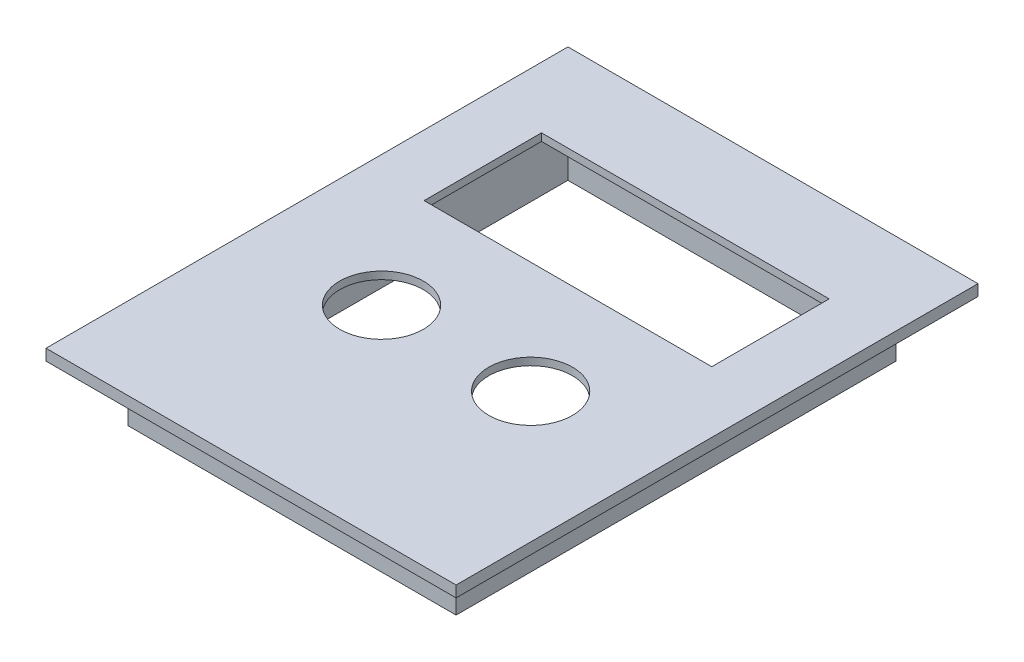
from build123d import *

# Parameters (mm, degrees)
SKETCH1_W           = 139.7
SKETCH1_H           = 177.8
BOSS_EXTRUDE1_DEPTH = 3.81
SKETCH2_W           = 111.76
SKETCH2_H           = 149.86
BOSS_EXTRUDE2_DEPTH = 19.05
SHELL1_START        = -72.39
SHELL1_OUTLINE_W    = 106.68
SHELL1_OUTLINE_H    = 20.32
SHELL1_DEPTH        = 144.78
SKETCH3_R           = 14.25
SKETCH3_W           = 98
SKETCH3_H           = 40
CUT_EXTRUDE1_DEPTH  = 116.346487159
SKETCH4_R           = 3
SKETCH4_R_2         = 1.25
BOSS_EXTRUDE3_DEPTH = 2.54


# Read off the part's stored shape, not the designer's step: Shell1
with BuildPart() as part:
    # Sketch1 → Boss-Extrude1 (new body)
    with BuildSketch(Plane(origin=(0, 0, 0), x_dir=(1, 0, 0), z_dir=(0, 1, 0))):
        Rectangle(SKETCH1_W, SKETCH1_H)
    extrude(amount=BOSS_EXTRUDE1_DEPTH)

    # Sketch2 → Boss-Extrude2 (add)
    with BuildSketch(Plane.XZ):
        Rectangle(SKETCH2_W, SKETCH2_H)
    extrude(amount=BOSS_EXTRUDE2_DEPTH)

    # Shell1 outline → Shell1 (cut)
    with BuildSketch(Plane.XY.offset(SHELL1_START)):
        with Locations((0, -8.89)):
            Rectangle(SHELL1_OUTLINE_W, SHELL1_OUTLINE_H)
    extrude(amount=SHELL1_DEPTH, mode=Mode.SUBTRACT)

    # Sketch3 → Cut-Extrude1 (cut, through all)
    with BuildSketch(Plane(origin=(0, 3.81, 0), x_dir=(1, 0, 0), z_dir=(0, 1, 0))):
        with Locations(Location((-25.4, -19.05, 0), (0, 0, 270))):
            Circle(SKETCH3_R)
        with Locations(Location((25.4, -19.05, 0), (0, 0, 270))):
            Circle(SKETCH3_R)
        with Locations((0, 39.05)):
            Rectangle(SKETCH3_W, SKETCH3_H)
    extrude(amount=-CUT_EXTRUDE1_DEPTH, mode=Mode.SUBTRACT)

    # Sketch4 → Boss-Extrude3 (add)
    # profile 1 of 4: a face of its own
    with BuildSketch(Plane.XZ.offset(-1.27)):
        with Locations(Location((-46.5, -11.55, 0), (0, 0, 90))):
            Circle(SKETCH4_R)
        with Locations(Location((-46.5, -11.55, 0), (0, 0, 270))):
            Circle(SKETCH4_R_2, mode=Mode.SUBTRACT)
    # profile 2 of 4: a face of its own
    with BuildSketch(Plane.XZ.offset(-1.27)):
        with Locations(Location((46.5, -11.55, 0), (0, 0, 90))):
            Circle(SKETCH4_R)
        with Locations(Location((46.5, -11.55, 0), (0, 0, 270))):
            Circle(SKETCH4_R_2, mode=Mode.SUBTRACT)
    # profile 3 of 4: a face of its own
    with BuildSketch(Plane.XZ.offset(-1.27)):
        with Locations(Location((46.5, -66.55, 0), (0, 0, 90))):
            Circle(SKETCH4_R)
        with Locations(Location((46.5, -66.55, 0), (0, 0, 270))):
            Circle(SKETCH4_R_2, mode=Mode.SUBTRACT)
    # profile 4 of 4: a face of its own
    with BuildSketch(Plane.XZ.offset(-1.27)):
        with Locations(Location((-46.5, -66.55, 0), (0, 0, 90))):
            Circle(SKETCH4_R)
        with Locations(Location((-46.5, -66.55, 0), (0, 0, 270))):
            Circle(SKETCH4_R_2, mode=Mode.SUBTRACT)
    extrude(amount=BOSS_EXTRUDE3_DEPTH)


solid = part.part
